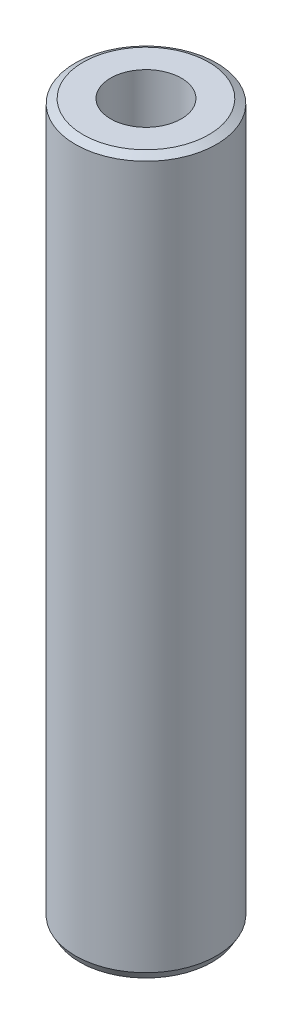
from build123d import *
from OCP.BRepFilletAPI import BRepFilletAPI_MakeChamfer

# Parameters (mm, degrees)
SKETCH1_R           = 55
BOSS_EXTRUDE1_DEPTH = 556.911873486
SKETCH2_R           = 27.549245445
CUT_EXTRUDE1_DEPTH  = 563.317379093
CHAMFER1_SIZE       = 3.490018922
CHAMFER1_SIZE2      = 6.044890092


with BuildPart() as part:
    # Sketch1 → Boss-Extrude1 (new body)
    with BuildSketch(Plane(origin=(0, 0, 0), x_dir=(1, 0, 0), z_dir=(0, 1, 0))):
        Circle(SKETCH1_R)
    extrude(amount=BOSS_EXTRUDE1_DEPTH)

    # Sketch2 → Cut-Extrude1 (cut, through all)
    with BuildSketch(Plane(origin=(0, 0, 0), x_dir=(1, 0, 0), z_dir=(0, 1, 0))):
        Circle(SKETCH2_R)
    extrude(amount=CUT_EXTRUDE1_DEPTH, mode=Mode.SUBTRACT)

    # Chamfer1: one chamfer whose edges measure the first distance from different faces: ONE call of the kernel's chamfer builder (chamfer() names one face for all edges)
    chamfer1_edges_1 = [part.edges().sort_by_distance(p)[0] for p in [
        (-55, 556.911873486, 0),
    ]]
    chamfer1_side_1 = [part.faces().sort_by_distance(p)[0] for p in [
        (-55, 278.455936743, 0),
    ]]
    chamfer1_edges_2 = [part.edges().sort_by_distance(p)[0] for p in [
        (-55, 0, 0),
    ]]
    chamfer1_side_2 = [part.faces().sort_by_distance(p)[0] for p in [
        (-53.444365081, 0, 0),
    ]]
    chamfer1 = BRepFilletAPI_MakeChamfer(part.part.solid().wrapped)
    for e in chamfer1_edges_1:
        chamfer1.Add(CHAMFER1_SIZE, CHAMFER1_SIZE2, e.wrapped, chamfer1_side_1[0].wrapped)  # the first distance lies on this face
    for e in chamfer1_edges_2:
        chamfer1.Add(CHAMFER1_SIZE, CHAMFER1_SIZE2, e.wrapped, chamfer1_side_2[0].wrapped)  # the first distance lies on this face
    add(Compound.cast(chamfer1.Shape()), mode=Mode.REPLACE)


solid = part.part
